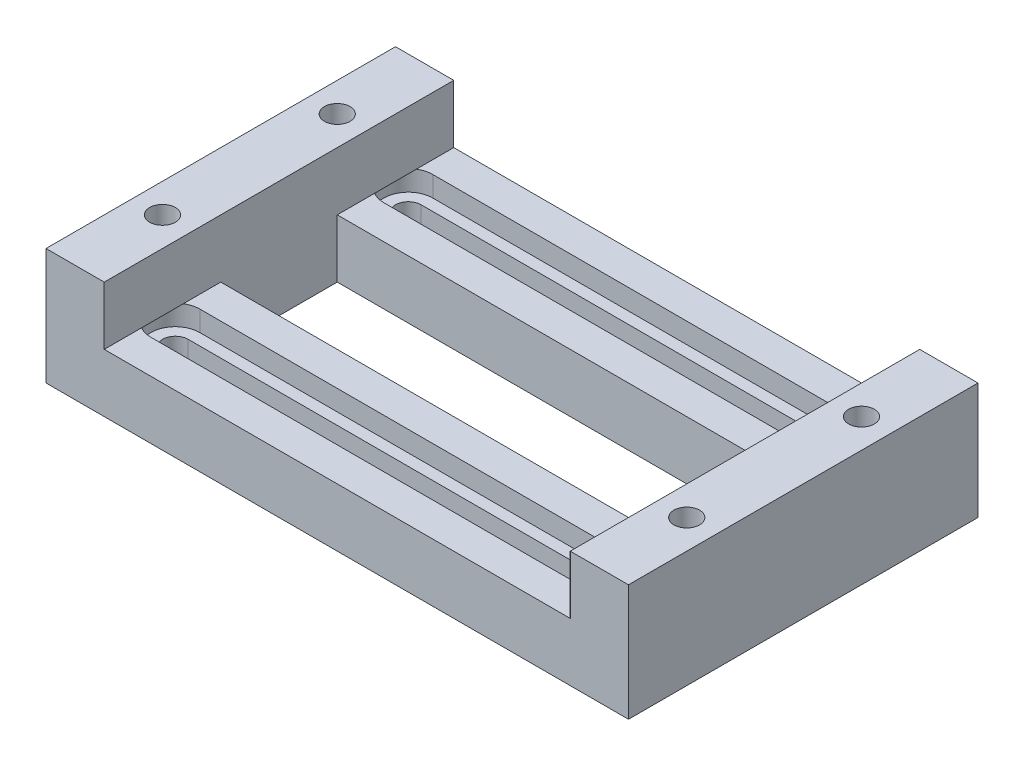
from build123d import *

# Parameters (mm, degrees)
SKETCH1_R             = 2.2
BOSS_EXTRUDE1_DEPTH   = 10
CUT_SLOT_INSETS_DEPTH = 3.5
SKETCH5_W             = 10
SKETCH5_H             = 60
SKETCH5_R             = 2.2
BOSS_EXTRUDE3_DEPTH   = 10
SKETCH6_R             = 4.215
CUT_EXTRUDE1_DEPTH    = 2.5
CHAMFER1_SIZE         = 0.5
CHAMFER2_SIZE         = 1


with BuildPart() as part:
    # Sketch1 → Boss-Extrude1 (new body)
    with BuildSketch(Plane(origin=(0, 0, 0), x_dir=(1, 0, 0), z_dir=(0, 1, 0))):
        Polygon((100, 60), (50, 60), (0, 60), (0, 0), (100, 0), align=None)
        with Locations((5, 15)):
            Circle(SKETCH1_R, mode=Mode.SUBTRACT)
        with BuildLine():
            ThreePointArc((12.2, 7.8), (10, 10), (12.2, 12.2))
            Line((12.2, 12.2), (87.8, 12.2))
            ThreePointArc((87.8, 12.2), (90, 10), (87.8, 7.8))
            Line((87.8, 7.8), (12.2, 7.8))
        make_face(mode=Mode.SUBTRACT)
        Polygon((10, 20), (10, 40), (50, 40), (90, 40), (90, 20), align=None, mode=Mode.SUBTRACT)
        with Locations((95, 15)):
            Circle(SKETCH1_R, mode=Mode.SUBTRACT)
        with Locations((5, 45)):
            Circle(SKETCH1_R, mode=Mode.SUBTRACT)
        with BuildLine():
            Line((87.8, 47.8), (50, 47.8))
            Line((50, 47.8), (12.2, 47.8))
            ThreePointArc((12.2, 47.8), (10, 50), (12.2, 52.2))
            Line((12.2, 52.2), (50, 52.2))
            Line((50, 52.2), (87.8, 52.2))
            ThreePointArc((87.8, 52.2), (90, 50), (87.8, 47.8))
        make_face(mode=Mode.SUBTRACT)
        with Locations((95, 45)):
            Circle(SKETCH1_R, mode=Mode.SUBTRACT)
    extrude(amount=BOSS_EXTRUDE1_DEPTH)

    # Sketch3 → Cut-Slot insets (cut)
    with BuildSketch(Plane(origin=(0, 10, 0), x_dir=(1, 0, 0), z_dir=(0, 1, 0))):
        with BuildLine():
            Line((87.8, 14.2), (12.2, 14.2))
            ThreePointArc((12.2, 14.2), (8, 10), (12.2, 5.8))
            Line((12.2, 5.8), (87.8, 5.8))
            ThreePointArc((87.8, 5.8), (92, 10), (87.8, 14.2))
        make_face()
        with BuildLine():
            Line((87.8, 54.2), (12.2, 54.2))
            ThreePointArc((12.2, 54.2), (8, 50), (12.2, 45.8))
            Line((12.2, 45.8), (87.8, 45.8))
            ThreePointArc((87.8, 45.8), (92, 50), (87.8, 54.2))
        make_face()
    extrude(amount=-CUT_SLOT_INSETS_DEPTH, mode=Mode.SUBTRACT)

    # Sketch5 → Boss-Extrude3 (add)
    # profile 1 of 2: a face of its own
    with BuildSketch(Plane(origin=(0, 10, 0), x_dir=(1, 0, 0), z_dir=(0, 1, 0))):
        with Locations((5, 30)):
            Rectangle(SKETCH5_W, SKETCH5_H)
        with Locations((5, 15)):
            Circle(SKETCH5_R, mode=Mode.SUBTRACT)
        with Locations((5, 45)):
            Circle(SKETCH5_R, mode=Mode.SUBTRACT)
    # profile 2 of 2: a face of its own
    with BuildSketch(Plane(origin=(0, 10, 0), x_dir=(1, 0, 0), z_dir=(0, 1, 0))):
        with Locations((95, 30)):
            Rectangle(SKETCH5_W, SKETCH5_H)
        with Locations((95, 45)):
            Circle(SKETCH5_R, mode=Mode.SUBTRACT)
        with Locations((95, 15)):
            Circle(SKETCH5_R, mode=Mode.SUBTRACT)
    extrude(amount=BOSS_EXTRUDE3_DEPTH)

    # Sketch6 → Cut-Extrude1 (cut)
    with BuildSketch(Plane.XZ):
        with Locations((5, -45)):
            Circle(SKETCH6_R)
        with Locations((5, -15)):
            Circle(SKETCH6_R)
        with Locations((95, -15)):
            Circle(SKETCH6_R)
        with Locations((95, -45)):
            Circle(SKETCH6_R)
    extrude(amount=-CUT_EXTRUDE1_DEPTH, mode=Mode.SUBTRACT)

    # Chamfer1
    chamfer1_edges = [part.edges().sort_by_distance(p)[0] for p in [
        (50, 0, -52.2),
        (90, 0, -50),
        (10, 0, -50),
        (50, 0, -47.8),
        (50, 0, -7.8),
        (10, 0, -10),
        (90, 0, -10),
        (50, 0, -12.2),
    ]]
    chamfer(chamfer1_edges, length=CHAMFER1_SIZE)

    # Chamfer2
    chamfer2_edges = [part.edges().sort_by_distance(p)[0] for p in [
        (90.785, 2.5, -15),
        (90.785, 2.5, -45),
        (0.785, 2.5, -45),
        (0.785, 2.5, -15),
    ]]
    chamfer(chamfer2_edges, length=CHAMFER2_SIZE)


solid = part.part
